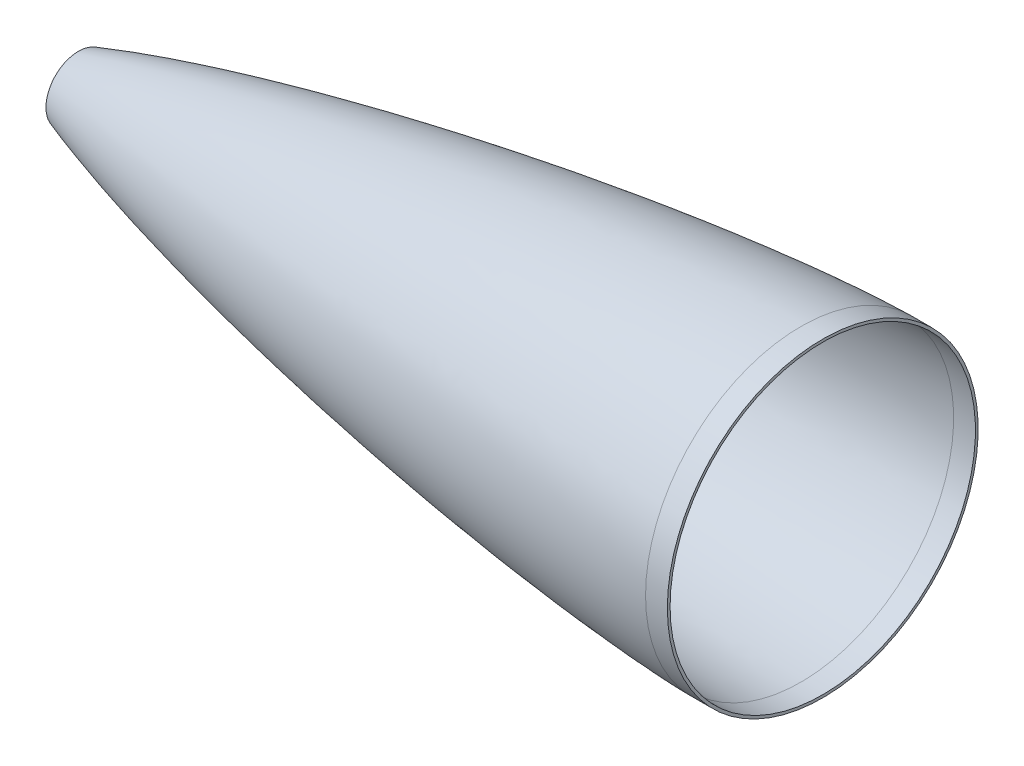
from build123d import *

# Parameters (mm, degrees)
SKETCH2_R          = 90.487499981
CUT_EXTRUDE1_DEPTH = 38.1


with BuildPart() as part:
    # Sketch1 → Revolve3 (revolve)
    with BuildSketch(Plane.XY):
        with BuildLine():
            Line((457.2, 88.899999981), (469.896492803, 88.899999981))
            Line((469.896492803, 88.899999981), (469.896492803, 90.487499981))
            Line((469.896492803, 90.487499981), (457.196492803, 90.487499981))
            add(Edge.make_bspline(
                [(-1.616766598, 0), (-1.609706081, 0.036603854), (-1.599024171, 0.091986054), (-1.584594662, 0.166761225), (-1.575721299, 0.212830561), (-1.567989242, 0.252769701), (-1.564601844, 0.270695715), (-1.559334425, 0.297344862), (-1.560855914, 0.290510696), (-1.534992184, 0.418086934), (-1.494532858, 0.550214297), (-1.437461597, 0.694969064), (-1.385661705, 0.805353859), (-1.302798082, 0.962391684), (-1.200433335, 1.123500708), (-1.048808335, 1.335993077), (-0.872143019, 1.551046624), (-0.667446383, 1.775436635), (-0.466392234, 1.978612612), (-0.200668916, 2.230798289), (0.129584237, 2.520758084), (0.525331379, 2.843343396), (1.054911987, 3.25010601), (1.719601637, 3.724506342), (2.524037332, 4.258994204), (3.602880254, 4.936116349), (4.965226762, 5.732614722), (7.164447008, 6.931760031), (9.94667931, 8.326359718), (13.31872504, 9.889949347), (17.852134084, 11.864515814), (23.569474889, 14.171133421), (30.487537617, 16.759663359), (37.446707578, 19.211031319), (44.439832216, 21.550646897), (53.800173606, 24.543839171), (65.555871429, 28.086109467), (79.730191969, 32.085060954), (93.95761019, 35.874512091), (108.228880572, 39.484026993), (122.537113061, 42.934848869), (141.657890219, 47.344532296), (165.629870802, 52.528396611), (194.488570031, 58.289882127), (223.42637845, 63.630333792), (252.433901222, 68.572321933), (281.504854708, 73.124922181), (310.634875556, 77.285909181), (339.821281806, 81.040503595), (369.063071827, 84.357636522), (393.477616031, 86.711872567), (413.039844947, 88.2952372), (427.726663604, 89.306404202), (439.985838863, 89.974461594), (449.798045996, 90.348238899), (454.732168929, 90.476611275), (457.196492803, 90.487499981)],
                knots=[-0.000651378, -0.000651378, -0.000651378, -0.000651378, -0.000413282, -0.000290711, -0.000168141, -0.000106855, -4.557e-05, -1.4927e-05, 3.94e-07, 1.5715e-05, 7.7e-05, 0.000138286, 0.000199571, 0.000322142, 0.000567283, 0.000812424, 0.001302706, 0.001792988, 0.00228327, 0.002773552, 0.003754117, 0.004734681, 0.005715245, 0.007676374, 0.009637503, 0.011598631, 0.015520889, 0.019443146, 0.027287661, 0.035132176, 0.04297669, 0.05866572, 0.074354749, 0.090043779, 0.105732808, 0.121421837, 0.152799896, 0.184177955, 0.215556014, 0.246934073, 0.278312132, 0.309690191, 0.372446308, 0.435202426, 0.497958544, 0.560714661, 0.623470779, 0.686226897, 0.748983015, 0.811739132, 0.87449525, 0.905873309, 0.937251368, 0.968629427, 0.984318456, 1.000007485, 1.000007485, 1.000007485, 1.000007485], degree=3))
            Line((-1.616766598, 0), (0, 0))
            add(Edge.make_bspline(
                [(0, 0), (0.002252326, 0.011676015), (0.008172498, 0.034601551), (0.025924078, 0.07868817), (0.069515821, 0.163009702), (0.133891919, 0.263104421), (0.219083202, 0.377874193), (0.336980112, 0.520691984), (0.508294819, 0.709916231), (0.796743276, 0.996314892), (1.297392915, 1.436984627), (2.171427967, 2.115548405), (3.700669892, 3.156129635), (6.415913097, 4.768274854), (11.136159186, 7.198190988), (18.882543075, 10.659186), (32.161816521, 15.828571543), (51.229171373, 22.241878784), (75.23036556, 29.337949289), (102.988289697, 36.657803249), (131.619753695, 43.511950241), (160.374510852, 49.827259848), (189.22769389, 55.674239309), (218.163982111, 61.094544577), (247.172465418, 66.113329232), (276.245797951, 70.741694957), (305.378606257, 74.979662903), (334.567274001, 78.814730666), (363.809388761, 82.21995637), (389.441934274, 84.779668607), (411.445236254, 86.618046199), (428.63351735, 87.774473661), (439.738528717, 88.370701031), (448.426307528, 88.718662985), (453.439289178, 88.851920429), (455.946335944, 88.89446062), (457.2, 88.899999981)],
                knots=[0, 0, 0, 0, 0, 0.000101175, 0.000202351, 0.000404702, 0.000809403, 0.00111569, 0.001421978, 0.001985248, 0.002987861, 0.004583917, 0.007112661, 0.011425968, 0.018769715, 0.031526477, 0.052412239, 0.083827717, 0.14038342, 0.203214574, 0.266045748, 0.328876912, 0.391708076, 0.454539237, 0.517370407, 0.580201572, 0.643032736, 0.705863901, 0.768695068, 0.831526236, 0.894357403, 0.925772984, 0.957188566, 0.978594283, 0.989297141, 1, 1, 1, 1, 1], degree=4))
        make_face()
    revolve(axis=Axis((0, 0, 0), (1, 0, 0)))

    # Sketch2 → Cut-Extrude1 (cut)
    with BuildSketch(Plane(origin=(-1.616766631, 0, 0), x_dir=(0, 0, -1), z_dir=(1, 0, 0))):
        Circle(SKETCH2_R)
    extrude(amount=CUT_EXTRUDE1_DEPTH, mode=Mode.SUBTRACT)


solid = part.part
